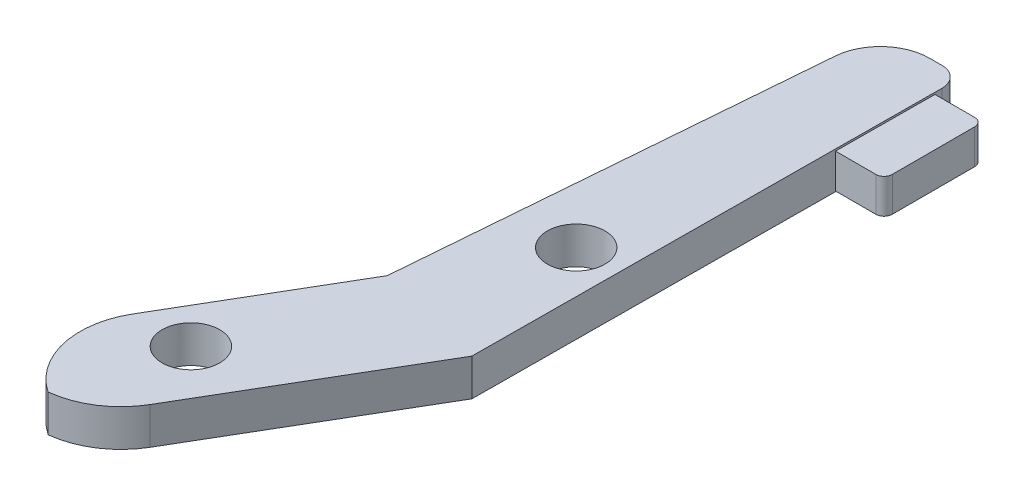
from build123d import *

# Parameters (mm, degrees)
BOSS_EXTRUDE1_DEPTH = 2.25
FILLET1_R           = 5
BOSS_EXTRUDE2_REACH = 40.996
SKETCH4_W           = 6
SKETCH4_H           = 2.1
SKETCH4_2_W         = 6
SKETCH4_2_H         = 2.1
BOSS_EXTRUDE3_DEPTH = 2.908330475
FILLET2_R           = 3
FILLET3_R           = 1.2
FILLET4_R           = 0.5
SKETCH2_R           = 1.75
CUT_EXTRUDE1_DEPTH  = 10


with BuildPart() as part:
    # Sketch1 → Boss-Extrude1 (new body)
    with BuildSketch(Plane(origin=(0, 0, 0), x_dir=(1, 0, 0), z_dir=(0, 1, 0))):
        Polygon((0, 0), (9.103642727, 15.528157943), (11.383305122, 43.435202562), (16.102594303, 43.435202562), (15.904357834, 13.869762926), (6.800715107, -1.658395017), align=None)
    extrude(amount=BOSS_EXTRUDE1_DEPTH)

    # Fillet1
    # the kernel refuses this fillet: 5 mm, written as the material it takes off along each edge
    with BuildSketch(Plane(origin=(6.800715107, -9.304114403, 1.658395017), x_dir=(0.5057579292685198, 0, -0.8626754412767405), z_dir=(0, 1, 0))) as fillet1_piece_1:
        with BuildLine():
            CenterArc((FILLET1_R * 0.744329152265, FILLET1_R), FILLET1_R, 196.677230039, 73.322769961)
            Line((-FILLET1_R * 0.213607467111, FILLET1_R * 0.713020151823), (0, 0))
            Line((0, 0), (FILLET1_R * 0.744329152265, 0))
        make_face()
    extrude(amount=20.858228807, mode=Mode.SUBTRACT)
    with BuildSketch(Plane(origin=(0, -16.79364561, 0), x_dir=(0.5057579292685198, 0, -0.8626754412767405), z_dir=(0, 1, 0))) as fillet1_piece_2:
        with BuildLine():
            CenterArc((FILLET1_R * 1.34349164877, -FILLET1_R), FILLET1_R, 90, 106.677230039)
            Line((FILLET1_R * 0.38555502939, -FILLET1_R * 1.28697984818), (0, 0))
            Line((0, 0), (FILLET1_R * 1.34349164877, 0))
        make_face()
    extrude(amount=35.837291219, mode=Mode.SUBTRACT)

    # Boss-Extrude2: up to this plane
    boss_extrude2_end = Plane(origin=(15.904357834, 2.25, -13.869762926), z_dir=(-0.9999775222008104, 0, -0.006704855936389689))
    # Sketch4 → Boss-Extrude2 (add, up to the surface)
    with BuildSketch(Plane(origin=(19, -1.484709168, -8.201879583), x_dir=(0, 0, -1), z_dir=(1, 0, 0)), mode=Mode.PRIVATE) as boss_extrude2_sk1:
        with Locations((30.603976534, 2.57086864)):
            Rectangle(SKETCH4_W, SKETCH4_H)
    boss_extrude2_tool1 = split(extrude(boss_extrude2_sk1.sketch, amount=-BOSS_EXTRUDE2_REACH, mode=Mode.PRIVATE), bisect_by=boss_extrude2_end, keep=Keep.BOTH, mode=Mode.PRIVATE)
    add(boss_extrude2_tool1.solids().sort_by_distance((19, 1.086159, -38.805856))[0])

    # Sketch4<2> → Boss-Extrude3 (add)
    with BuildSketch(Plane(origin=(19, -1.484709168, -8.201879583), x_dir=(0, 0, -1), z_dir=(1, 0, 0))):
        with Locations((30.603976534, 2.57086864)):
            Rectangle(SKETCH4_2_W, SKETCH4_2_H)
    extrude(amount=-BOSS_EXTRUDE3_DEPTH)

    # Fillet2
    fillet2_edges = [part.edges().sort_by_distance(p)[0] for p in [
        (11.383305122, 1.125, -43.435202562),
    ]]
    fillet(fillet2_edges, radius=FILLET2_R)

    # Fillet3
    fillet3_edges = [part.edges().sort_by_distance(p)[0] for p in [
        (16.102594303, 1.125, -43.435202562),
    ]]
    fillet(fillet3_edges, radius=FILLET3_R)

    # Fillet4
    fillet4_edges = [part.edges().sort_by_distance(p)[0] for p in [
        (19, 1.086159472, -41.805856117),
        (19, 1.086159472, -35.805856117),
    ]]
    fillet(fillet4_edges, radius=FILLET4_R)

    # Sketch2 → Cut-Extrude1 (cut)
    with BuildSketch(Plane(origin=(0, 2.25, 0), x_dir=(1, 0, 0), z_dir=(0, 1, 0))):
        with Locations(Location((6.857494693, 5.853068737, 0), (0, 0, 270))):
            Circle(SKETCH2_R)
        with Locations(Location((13.362356268, 22.747397122, 0), (0, 0, 270))):
            Circle(SKETCH2_R)
    extrude(amount=-CUT_EXTRUDE1_DEPTH, mode=Mode.SUBTRACT)


solid = part.part
